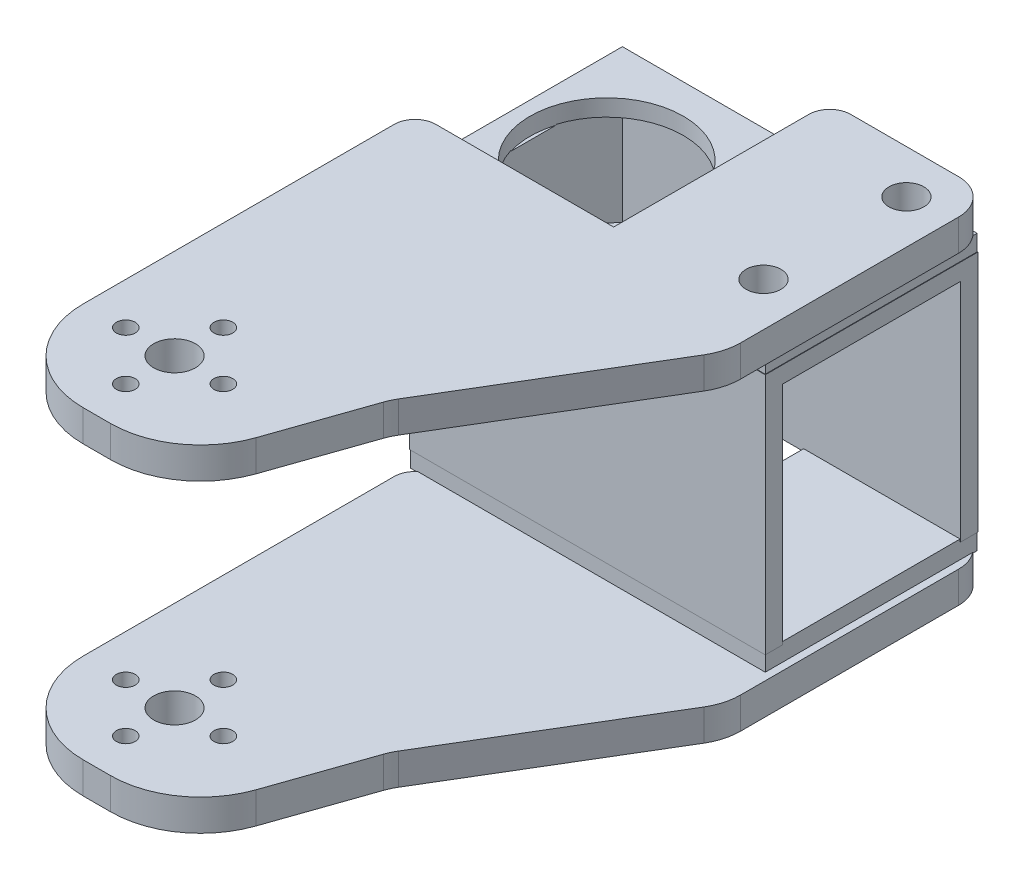
from build123d import *

# Parameters (mm, degrees)
BOSS_1_DEPTH  = 4.5
S_CYL2_R      = 9
BOSS_2_DEPTH  = 2
BOSS_3_DEPTH  = 4.5
S_BOX4_W      = 2.5
S_BOX4_H      = 34.8
BOSS_4_DEPTH  = 30.52
S_BOX5_W      = 51.02
S_BOX5_H      = 34.8
BOSS_5_DEPTH  = 2.5
S_BOX6_W      = 51.02
S_BOX6_H      = 34.8
BOSS_6_DEPTH  = 2.5
S_BOX7_W      = 51.02
S_BOX7_H      = 2.4
BOSS_7_DEPTH  = 30.52
S_BOX8_W      = 22.44
S_BOX8_H      = 2.675
BOSS_8_DEPTH  = 30.38
S_BOX9_W      = 28.47
S_BOX9_H      = 2.675
BOSS_9_DEPTH  = 1.69
S_BOX10_W     = 22.44
S_BOX10_H     = 2.425
BOSS_10_DEPTH = 30.38
S_BOX11_W     = 28.47
S_BOX11_H     = 2.425
BOSS_11_DEPTH = 1.69
S_HOLE12_R    = 3
HOLE_12_DEPTH = 4.7
S_HOLE13_R    = 1.35
HOLE_13_DEPTH = 4.7
S_HOLE14_R    = 1.35
HOLE_14_DEPTH = 4.7
S_HOLE15_R    = 1.35
HOLE_15_DEPTH = 4.7
S_HOLE16_R    = 1.35
HOLE_16_DEPTH = 4.7
S_HOLE17_R    = 3
HOLE_17_DEPTH = 6.7
S_HOLE18_R    = 1.35
HOLE_18_DEPTH = 6.7
S_HOLE19_R    = 1.35
HOLE_19_DEPTH = 6.7
S_HOLE20_R    = 1.35
HOLE_20_DEPTH = 6.7
S_HOLE21_R    = 1.35
HOLE_21_DEPTH = 6.7
S_HOLE22_R    = 11
HOLE_22_DEPTH = 2.6
S_HOLE23_R    = 1.1
HOLE_23_DEPTH = 2.6
S_HOLE24_R    = 1.1
HOLE_24_DEPTH = 2.6
S_HOLE25_R    = 1.1
HOLE_25_DEPTH = 2.6
S_HOLE26_R    = 2.5
HOLE_26_DEPTH = 6.775
S_HOLE27_R    = 2.5
HOLE_27_DEPTH = 6.775


with BuildPart() as part:
    # S_prism1 → Boss_1 (new body)
    with BuildSketch(Plane(origin=(0, -23.125, 0), x_dir=(1, 0, 0), z_dir=(0, 1, 0))):
        with BuildLine():
            Line((-0.1, -13), (3.8289, -13))
            ThreePointArc((3.8289, -13), (11.303548347, -10.613765629), (16.0129, -4.3379))
            Line((16.0129, -4.3379), (20.7288, 9.2202))
            ThreePointArc((20.7288, 9.2202), (21.038506496, 9.982013886), (21.4248, 10.708))
            Line((21.4248, 10.708), (37.8599, 38.0999))
            ThreePointArc((37.8599, 38.0999), (38.709702939, 40.080410611), (39, 42.2159))
            Line((39, 42.2159), (39, 73.5))
            ThreePointArc((39, 73.5), (37.5355, 77.0355), (34, 78.5))
            Line((34, 78.5), (18.5, 78.5))
            ThreePointArc((18.5, 78.5), (16.3787, 77.6213), (15.5, 75.5))
            Line((15.5, 75.5), (15.5, 47.5))
            Line((15.5, 47.5), (-10, 47.5))
            ThreePointArc((-10, 47.5), (-12.1213, 46.6213), (-13, 44.5))
            Line((-13, 44.5), (-13, -0.1))
            ThreePointArc((-13, -0.1), (-9.2217, -9.2217), (-0.1, -13))
        make_face()
    extrude(amount=BOSS_1_DEPTH)



with BuildPart() as body_2:
    # S_cyl2 → Boss_2 (new body)
    with BuildSketch(Plane(origin=(0, 18.625, 0), x_dir=(1, 0, 0), z_dir=(0, 1, 0))):
        Circle(S_CYL2_R)
    extrude(amount=BOSS_2_DEPTH)

    # S_prism3 → Boss_3 (add)
    with BuildSketch(Plane(origin=(0, 20.625, 0), x_dir=(1, 0, 0), z_dir=(0, 1, 0))):
        with BuildLine():
            Line((-0.1, -13), (3.8289, -13))
            ThreePointArc((3.8289, -13), (11.303548347, -10.613765629), (16.0129, -4.3379))
            Line((16.0129, -4.3379), (20.7288, 9.2202))
            ThreePointArc((20.7288, 9.2202), (21.038506496, 9.982013886), (21.4248, 10.708))
            Line((21.4248, 10.708), (37.8599, 38.0999))
            ThreePointArc((37.8599, 38.0999), (38.709702939, 40.080410611), (39, 42.2159))
            Line((39, 42.2159), (39, 73.5))
            ThreePointArc((39, 73.5), (37.5355, 77.0355), (34, 78.5))
            Line((34, 78.5), (18.5, 78.5))
            ThreePointArc((18.5, 78.5), (16.3787, 77.6213), (15.5, 75.5))
            Line((15.5, 75.5), (15.5, 47.5))
            Line((15.5, 47.5), (-10, 47.5))
            ThreePointArc((-10, 47.5), (-12.1213, 46.6213), (-13, 44.5))
            Line((-13, 44.5), (-13, -0.1))
            ThreePointArc((-13, -0.1), (-9.2217, -9.2217), (-0.1, -13))
        make_face()
    extrude(amount=BOSS_3_DEPTH)


with BuildPart() as body_3:
    # S_box4 → Boss_4 (new body)
    with BuildSketch(Plane.XY.offset(-77.26)):
        with Locations((-11.76, 1)):
            Rectangle(S_BOX4_W, S_BOX4_H)
    extrude(amount=BOSS_4_DEPTH)

    # S_box5 → Boss_5 (add)
    with BuildSketch(Plane.XY.offset(-77.26)):
        with Locations((12.5, 1)):
            Rectangle(S_BOX5_W, S_BOX5_H)
    extrude(amount=BOSS_5_DEPTH)

    # S_box6 → Boss_6 (add)
    with BuildSketch(Plane.XY.offset(-49.24)):
        with Locations((12.5, 1)):
            Rectangle(S_BOX6_W, S_BOX6_H)
    extrude(amount=BOSS_6_DEPTH)

    # S_box7 → Boss_7 (add)
    with BuildSketch(Plane.XY.offset(-77.26)):
        with Locations((12.5, 17.2)):
            Rectangle(S_BOX7_W, S_BOX7_H)
    extrude(amount=BOSS_7_DEPTH)


with BuildPart() as part_1:
    add(part.part)

    add(body_3.part)  # Boss_8 merges body 3
    # S_box8 → Boss_8 (add)
    with BuildSketch(Plane.XY.offset(-77.19)):
        with Locations((26.72, -17.3875)):
            Rectangle(S_BOX8_W, S_BOX8_H)
    extrude(amount=BOSS_8_DEPTH)

    # S_box9 → Boss_9 (add)
    with BuildSketch(Plane.XY.offset(-48.5)):
        with Locations((1.295, -17.3875)):
            Rectangle(S_BOX9_W, S_BOX9_H)
    extrude(amount=BOSS_9_DEPTH)


    add(body_2.part)  # Boss_10 merges body 2
    # S_box10 → Boss_10 (add)
    with BuildSketch(Plane.XY.offset(-77.19)):
        with Locations((26.72, 19.5125)):
            Rectangle(S_BOX10_W, S_BOX10_H)
    extrude(amount=BOSS_10_DEPTH)

    # S_box11 → Boss_11 (add)
    with BuildSketch(Plane.XY.offset(-48.5)):
        with Locations((1.295, 19.5125)):
            Rectangle(S_BOX11_W, S_BOX11_H)
    extrude(amount=BOSS_11_DEPTH)

    # S_hole12 → Hole_12 (cut)
    with BuildSketch(Plane(origin=(0, -23.225, 0), x_dir=(1, 0, 0), z_dir=(0, 1, 0))):
        Circle(S_HOLE12_R)
    extrude(amount=HOLE_12_DEPTH, mode=Mode.SUBTRACT)

    # S_hole13 → Hole_13 (cut)
    with BuildSketch(Plane(origin=(0, -23.225, 0), x_dir=(1, 0, 0), z_dir=(0, 1, 0))):
        with Locations((7, 0)):
            Circle(S_HOLE13_R)
    extrude(amount=HOLE_13_DEPTH, mode=Mode.SUBTRACT)

    # S_hole14 → Hole_14 (cut)
    with BuildSketch(Plane(origin=(0, -23.225, 0), x_dir=(1, 0, 0), z_dir=(0, 1, 0))):
        with Locations((0, -7)):
            Circle(S_HOLE14_R)
    extrude(amount=HOLE_14_DEPTH, mode=Mode.SUBTRACT)

    # S_hole15 → Hole_15 (cut)
    with BuildSketch(Plane(origin=(0, -23.225, 0), x_dir=(1, 0, 0), z_dir=(0, 1, 0))):
        with Locations((-7, 0)):
            Circle(S_HOLE15_R)
    extrude(amount=HOLE_15_DEPTH, mode=Mode.SUBTRACT)

    # S_hole16 → Hole_16 (cut)
    with BuildSketch(Plane(origin=(0, -23.225, 0), x_dir=(1, 0, 0), z_dir=(0, 1, 0))):
        with Locations((0, 7)):
            Circle(S_HOLE16_R)
    extrude(amount=HOLE_16_DEPTH, mode=Mode.SUBTRACT)

    # S_hole17 → Hole_17 (cut)
    with BuildSketch(Plane(origin=(0, 18.525, 0), x_dir=(1, 0, 0), z_dir=(0, 1, 0))):
        Circle(S_HOLE17_R)
    extrude(amount=HOLE_17_DEPTH, mode=Mode.SUBTRACT)

    # S_hole18 → Hole_18 (cut)
    with BuildSketch(Plane(origin=(0, 18.525, 0), x_dir=(1, 0, 0), z_dir=(0, 1, 0))):
        with Locations((7, 0)):
            Circle(S_HOLE18_R)
    extrude(amount=HOLE_18_DEPTH, mode=Mode.SUBTRACT)

    # S_hole19 → Hole_19 (cut)
    with BuildSketch(Plane(origin=(0, 18.525, 0), x_dir=(1, 0, 0), z_dir=(0, 1, 0))):
        with Locations((0, -7)):
            Circle(S_HOLE19_R)
    extrude(amount=HOLE_19_DEPTH, mode=Mode.SUBTRACT)

    # S_hole20 → Hole_20 (cut)
    with BuildSketch(Plane(origin=(0, 18.525, 0), x_dir=(1, 0, 0), z_dir=(0, 1, 0))):
        with Locations((-7, 0)):
            Circle(S_HOLE20_R)
    extrude(amount=HOLE_20_DEPTH, mode=Mode.SUBTRACT)

    # S_hole21 → Hole_21 (cut)
    with BuildSketch(Plane(origin=(0, 18.525, 0), x_dir=(1, 0, 0), z_dir=(0, 1, 0))):
        with Locations((0, 7)):
            Circle(S_HOLE21_R)
    extrude(amount=HOLE_21_DEPTH, mode=Mode.SUBTRACT)

    # S_hole22 → Hole_22 (cut)
    with BuildSketch(Plane(origin=(0, 15.9, 0), x_dir=(1, 0, 0), z_dir=(0, 1, 0))):
        with Locations((0, 62)):
            Circle(S_HOLE22_R)
    extrude(amount=HOLE_22_DEPTH, mode=Mode.SUBTRACT)

    # S_hole23 → Hole_23 (cut)
    with BuildSketch(Plane(origin=(0, 15.9, 0), x_dir=(1, 0, 0), z_dir=(0, 1, 0))):
        with Locations((8.3, 51.75)):
            Circle(S_HOLE23_R)
    extrude(amount=HOLE_23_DEPTH, mode=Mode.SUBTRACT)

    # S_hole24 → Hole_24 (cut)
    with BuildSketch(Plane(origin=(0, 15.9, 0), x_dir=(1, 0, 0), z_dir=(0, 1, 0))):
        with Locations((32.75, 72.25)):
            Circle(S_HOLE24_R)
    extrude(amount=HOLE_24_DEPTH, mode=Mode.SUBTRACT)

    # S_hole25 → Hole_25 (cut)
    with BuildSketch(Plane(origin=(0, 15.9, 0), x_dir=(1, 0, 0), z_dir=(0, 1, 0))):
        with Locations((32.75, 51.75)):
            Circle(S_HOLE25_R)
    extrude(amount=HOLE_25_DEPTH, mode=Mode.SUBTRACT)

    # S_hole26 → Hole_26 (cut)
    with BuildSketch(Plane(origin=(0, 18.45, 0), x_dir=(1, 0, 0), z_dir=(0, 1, 0))):
        with Locations((32.75, 72.25)):
            Circle(S_HOLE26_R)
    extrude(amount=HOLE_26_DEPTH, mode=Mode.SUBTRACT)

    # S_hole27 → Hole_27 (cut)
    with BuildSketch(Plane(origin=(0, 18.45, 0), x_dir=(1, 0, 0), z_dir=(0, 1, 0))):
        with Locations((32.75, 51.75)):
            Circle(S_HOLE27_R)
    extrude(amount=HOLE_27_DEPTH, mode=Mode.SUBTRACT)


solid = part_1.part
